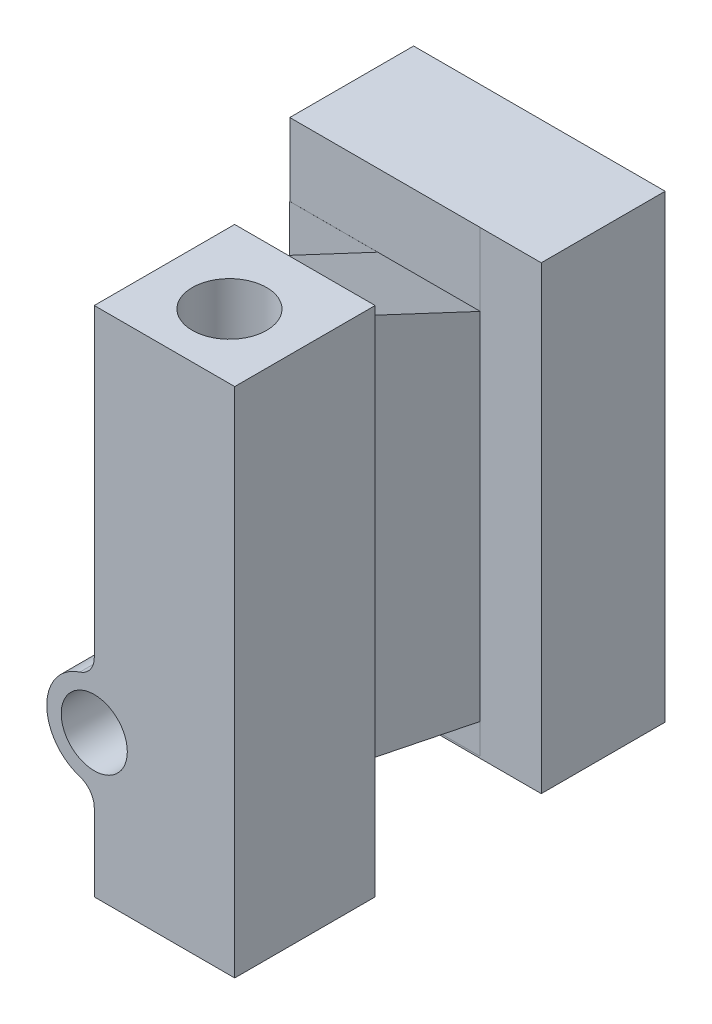
from build123d import *

# Parameters (mm, degrees)
SKETCH1_W           = 34
SKETCH1_H           = 124
BOSS_EXTRUDE1_DEPTH = 34
SKETCH2_R           = 11.504012884
BOSS_EXTRUDE2_DEPTH = 34
FILLET1_R           = 5
SKETCH3_R           = 13.586232418
CUT_EXTRUDE1_DEPTH  = 50
SKETCH4_R           = 8
CUT_EXTRUDE2_DEPTH  = 20
SKETCH5_W           = 24.830906905
SKETCH5_H           = 111.203932215
BOSS_EXTRUDE3_DEPTH = 30
SKETCH6_W           = 60.899939779
SKETCH6_H           = 111.310961987
BOSS_EXTRUDE4_DEPTH = 30
SKETCH7_R           = 8.998724885
CUT_EXTRUDE3_DEPTH  = 100
CUT_EXTRUDE5_DEPTH  = 100
SKETCH10_R          = 8.225036762
CUT_EXTRUDE6_DEPTH  = 10


with BuildPart() as part:
    # Sketch1 → Boss-Extrude1 (new body)
    with BuildSketch(Plane.XY):
        with Locations((-5.18125, -12.690625)):
            Rectangle(SKETCH1_W, SKETCH1_H)
    extrude(amount=BOSS_EXTRUDE1_DEPTH)

    # Sketch2 → Boss-Extrude2 (add)
    with BuildSketch(Plane.XY.offset(34)):
        with Locations((-22.18125, -40.250791069)):
            Circle(SKETCH2_R)
    extrude(amount=-BOSS_EXTRUDE2_DEPTH)

    # Fillet1
    fillet1_edges = [part.edges().sort_by_distance(p)[0] for p in [
        (-22.18125, -51.754803953, 17),
        (-22.18125, -28.746778185, 17),
    ]]
    fillet(fillet1_edges, radius=FILLET1_R)

    # Sketch3 → Cut-Extrude1 (cut)
    with BuildSketch(Plane.XZ.offset(74.690625)):
        with Locations((-4.893604294, 17.106225038)):
            Circle(SKETCH3_R)
    extrude(amount=-CUT_EXTRUDE1_DEPTH, mode=Mode.SUBTRACT)

    # Sketch4 → Cut-Extrude2 (cut)
    with BuildSketch(Plane.XY.offset(34)):
        with Locations((-22.18125, -40.250791069)):
            Circle(SKETCH4_R)
    extrude(amount=-CUT_EXTRUDE2_DEPTH, mode=Mode.SUBTRACT)

    # Sketch5 → Boss-Extrude3 (add)
    with BuildSketch(Plane(origin=(0, 0, 0), x_dir=(-1, 0, 0), z_dir=(0, 0, -1))):
        with Locations((5.153648801, -6.911017359)):
            Rectangle(SKETCH5_W, SKETCH5_H)
    extrude(amount=BOSS_EXTRUDE3_DEPTH)

    # Sketch6 → Boss-Extrude4 (add)
    with BuildSketch(Plane(origin=(0, 0, -30), x_dir=(-1, 0, 0), z_dir=(0, 0, -1))):
        with Locations((8.418056821, -7.285621558)):
            Rectangle(SKETCH6_W, SKETCH6_H)
    extrude(amount=BOSS_EXTRUDE4_DEPTH)

    # Sketch7 → Cut-Extrude3 (cut)
    with BuildSketch(Plane(origin=(0, 49.309375, 0), x_dir=(1, 0, 0), z_dir=(0, 1, 0))):
        with Locations((-5.091502482, -18.358859801)):
            Circle(SKETCH7_R)
    extrude(amount=-CUT_EXTRUDE3_DEPTH, mode=Mode.SUBTRACT)

    # Sketch9 → Cut-Extrude5 (cut)
    with BuildSketch(Plane(origin=(7.261804652, 0, 0), x_dir=(0, 0, -1), z_dir=(1, 0, 0))):
        Polygon((-0.011900431, 53.158400833), (-0.011900431, 44.862473141), (30.018715365, 30.783528167), (30.018715365, 53.158400833), align=None)
        Polygon((-0.011900431, -49.028418821), (-0.011900431, -66.373805341), (29.994778619, -69.28142928), (29.994778619, -55.173209223), align=None)
    extrude(amount=-CUT_EXTRUDE5_DEPTH, mode=Mode.SUBTRACT)

    # Sketch10 → Cut-Extrude6 (cut)
    with BuildSketch(Plane.ZY.offset(38.86802671)):
        with Locations((-47.982118262, -43.683554337)):
            Circle(SKETCH10_R)
    extrude(amount=-CUT_EXTRUDE6_DEPTH, mode=Mode.SUBTRACT)


solid = part.part
